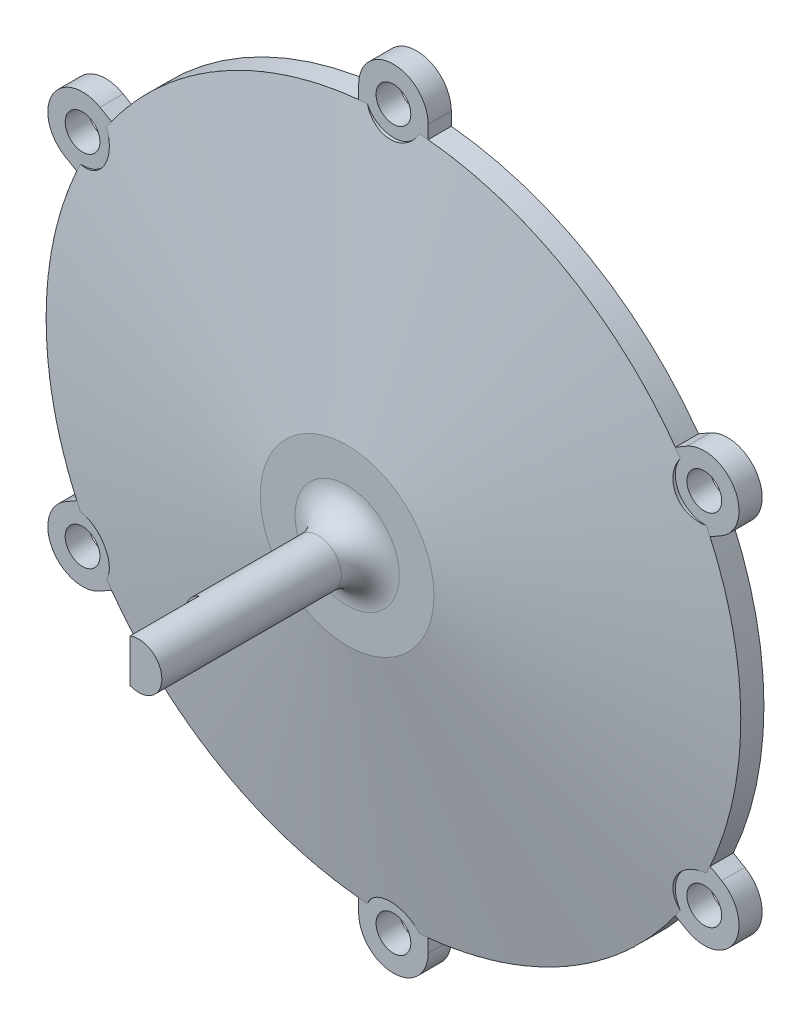
from build123d import *

# Parameters (mm, degrees)
SKETCH1_R           = 57
BOSS_EXTRUDE1_DEPTH = 4
SKETCH4_R           = 14
CUT_EXTRUDE1_DEPTH  = 7
SKETCH9_R           = 11.5
CUT_EXTRUDE4_DEPTH  = 0.5
SKETCH10_R          = 4
BOSS_EXTRUDE2_DEPTH = 36
FILLET1_R           = 5
SKETCH7_R           = 3
CUT_EXTRUDE2_DEPTH  = 101.796825347
SKETCH8_R           = 5
CUT_EXTRUDE3_DEPTH  = 101.796825347
CIRPATTERN6_COUNT   = 6
SKETCH11_W          = 2.5
SKETCH11_H          = 7.416198488
CUT_EXTRUDE5_DEPTH  = 12


with BuildPart() as part:
    # Sketch1 → Boss-Extrude1 (new body)
    with BuildSketch(Plane.XY):
        with BuildLine():
            ThreePointArc((6, 62), (0, 68), (-6, 62))
            Line((-6, 62), (-6, 59.699246226))
            ThreePointArc((-6, 59.699246226), (-30, 51.961524227), (-48.701063819, 35.045775536))
            Line((-48.701063819, 35.045775536), (-50.693575035, 36.196152423))
            ThreePointArc((-50.693575035, 36.196152423), (-58.889727457, 34), (-56.693575035, 25.803847577))
            Line((-56.693575035, 25.803847577), (-54.701063819, 24.65347069))
            ThreePointArc((-54.701063819, 24.65347069), (-60, 0), (-54.701063819, -24.65347069))
            Line((-54.701063819, -24.65347069), (-56.693575035, -25.803847577))
            ThreePointArc((-56.693575035, -25.803847577), (-58.889727457, -34), (-50.693575035, -36.196152423))
            Line((-50.693575035, -36.196152423), (-48.701063819, -35.045775536))
            ThreePointArc((-48.701063819, -35.045775536), (-30, -51.961524227), (-6, -59.699246226))
            Line((-6, -59.699246226), (-6, -62))
            ThreePointArc((-6, -62), (0, -68), (6, -62))
            Line((6, -62), (6, -59.699246226))
            ThreePointArc((6, -59.699246226), (30, -51.961524227), (48.701063819, -35.045775536))
            Line((48.701063819, -35.045775536), (50.693575035, -36.196152423))
            ThreePointArc((50.693575035, -36.196152423), (58.889727457, -34), (56.693575035, -25.803847577))
            Line((56.693575035, -25.803847577), (54.701063819, -24.65347069))
            ThreePointArc((54.701063819, -24.65347069), (60, 0), (54.701063819, 24.65347069))
            Line((54.701063819, 24.65347069), (56.693575035, 25.803847577))
            ThreePointArc((56.693575035, 25.803847577), (58.889727457, 34), (50.693575035, 36.196152423))
            Line((50.693575035, 36.196152423), (48.701063819, 35.045775536))
            ThreePointArc((48.701063819, 35.045775536), (30, 51.961524227), (6, 59.699246226))
            Line((6, 59.699246226), (6, 62))
        make_face()
        Circle(SKETCH1_R, mode=Mode.SUBTRACT)
    extrude(amount=BOSS_EXTRUDE1_DEPTH)

    # Sketch7 → Cut-Extrude2 (cut, through all)
    with BuildSketch(Plane.XY.offset(4)):
        with Locations((0, 62)):
            Circle(SKETCH7_R)
    cut_extrude2 = extrude(amount=-CUT_EXTRUDE2_DEPTH, mode=Mode.SUBTRACT)


with BuildPart() as body_2:
    # Sketch3 → Revolve1 (revolve)
    with BuildSketch(Plane(origin=(0, 0, 0), x_dir=(1, 0, 0), z_dir=(0, 1, 0))):
        Polygon((0, -0.5), (0, -12), (15, -12), (60, -4), (57, -4), (57, -0.5), align=None)
    revolve(axis=Axis((0, 0, 12), (0, 0, -1)))

    # Sketch4 → Cut-Extrude1 (cut)
    with BuildSketch(Plane.XY.offset(0.5)):
        Circle(SKETCH4_R)
    extrude(amount=CUT_EXTRUDE1_DEPTH, mode=Mode.SUBTRACT)

    # Sketch9 → Cut-Extrude4 (cut)
    with BuildSketch(Plane(origin=(0, 0, 7.5), x_dir=(-1, 0, 0), z_dir=(0, 0, -1))):
        Circle(SKETCH9_R)
    extrude(amount=-CUT_EXTRUDE4_DEPTH, mode=Mode.SUBTRACT)

    # Sketch10 → Boss-Extrude2 (add)
    with BuildSketch(Plane.XY.offset(12)):
        Circle(SKETCH10_R)
    extrude(amount=BOSS_EXTRUDE2_DEPTH)

    # Fillet1
    fillet1_edges = [body_2.edges().sort_by_distance(p)[0] for p in [
        (-4, 0, 12),
    ]]
    fillet(fillet1_edges, radius=FILLET1_R)

    # Sketch8 → Cut-Extrude3 (cut, through all)
    with BuildSketch(Plane.XY.offset(4)):
        with Locations((0, 62)):
            Circle(SKETCH8_R)
    cut_extrude3 = extrude(amount=CUT_EXTRUDE3_DEPTH, mode=Mode.SUBTRACT)


with BuildPart() as cirpattern6_tool:
    # CirPattern6: Cut-Extrude2, Cut-Extrude3 ×6 about axis
    cirpattern6_axis = Axis((0, 0, 4), (0, 0, 1))
    add([cut_extrude2.rotate(cirpattern6_axis, i * 360 / CIRPATTERN6_COUNT) for i in range(1, CIRPATTERN6_COUNT)])
    add([cut_extrude3.rotate(cirpattern6_axis, i * 360 / CIRPATTERN6_COUNT) for i in range(1, CIRPATTERN6_COUNT)])


with BuildPart() as part_1:
    add(part.part)

    # CirPattern6: cut by cirpattern6_tool
    add(cirpattern6_tool.part, mode=Mode.SUBTRACT)


with BuildPart() as body_2_1:
    add(body_2.part)

    # CirPattern6: cut by cirpattern6_tool
    add(cirpattern6_tool.part, mode=Mode.SUBTRACT)

    # Sketch11 → Cut-Extrude5 (cut)
    with BuildSketch(Plane.XY.offset(48)):
        with Locations((-2.75, 0)):
            Rectangle(SKETCH11_W, SKETCH11_H)
    extrude(amount=-CUT_EXTRUDE5_DEPTH, mode=Mode.SUBTRACT)


solid = Compound([part_1.part, body_2_1.part])
